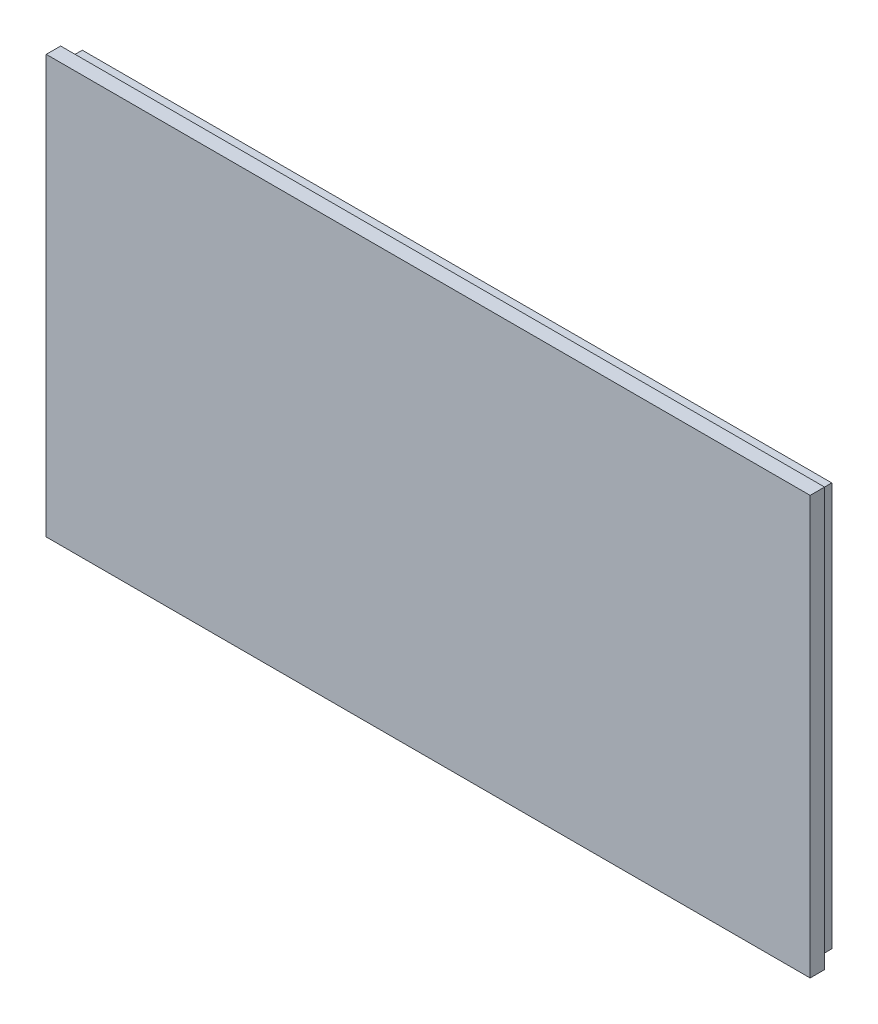
from build123d import *

# Parameters (mm, degrees)
SKETCH1_W           = 53
SKETCH1_H           = 29
BOSS_EXTRUDE1_DEPTH = 1
SKETCH2_W           = 52
SKETCH2_H           = 28
BOSS_EXTRUDE2_DEPTH = 1
SHELL1_START        = -1
SHELL1_OUTLINE_W    = 50
SHELL1_OUTLINE_H    = 26
SHELL1_DEPTH        = 1


# Read off the part's stored shape, not the designer's step: Shell1
with BuildPart() as part:
    # Sketch1 → Boss-Extrude1 (new body)
    with BuildSketch(Plane.XY):
        Rectangle(SKETCH1_W, SKETCH1_H)
    extrude(amount=BOSS_EXTRUDE1_DEPTH)

    # Sketch2 → Boss-Extrude2 (add)
    with BuildSketch(Plane(origin=(0, 0, 0), x_dir=(-1, 0, 0), z_dir=(0, 0, -1))):
        Rectangle(SKETCH2_W, SKETCH2_H)
    extrude(amount=BOSS_EXTRUDE2_DEPTH)

    # Shell1 outline → Shell1 (cut)
    with BuildSketch(Plane.XY.offset(SHELL1_START)):
        Rectangle(SHELL1_OUTLINE_W, SHELL1_OUTLINE_H)
    extrude(amount=SHELL1_DEPTH, mode=Mode.SUBTRACT)


solid = part.part
